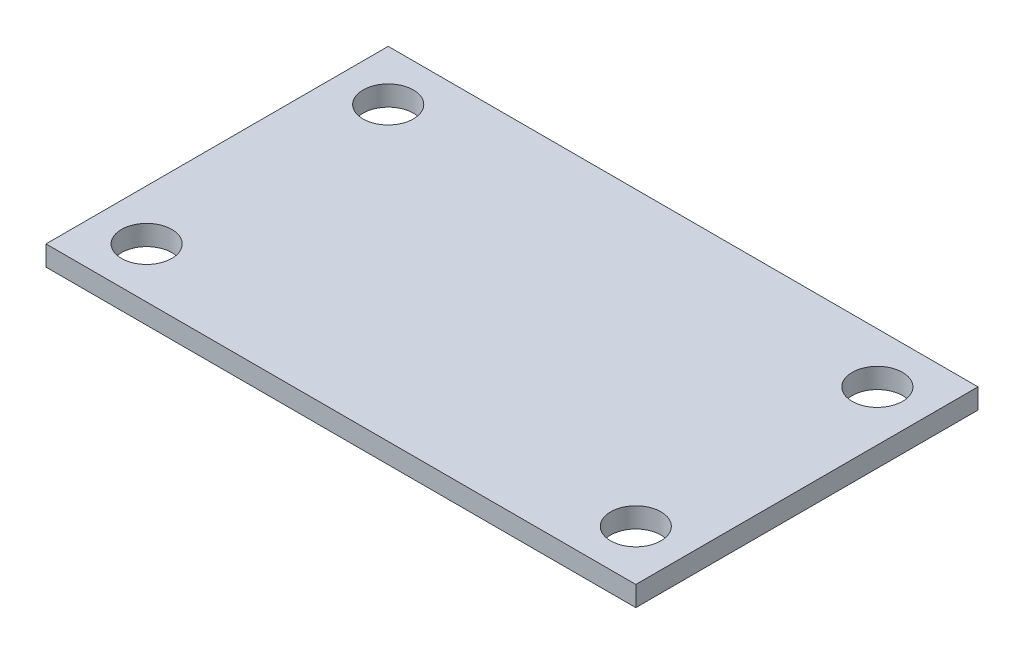
from build123d import *

# Parameters (mm, degrees)
SKETCH_1_W          = 29.3
SKETCH_1_H          = 17
EXTRUDE_1_DEPTH     = 1
SKETCH_2_R          = 1.25
CUT_EXTRUDE_1_DEPTH = 1


with BuildPart() as part:
    # 草图1 → 凸台-拉伸1 (new body)
    with BuildSketch(Plane(origin=(0, 0, 0), x_dir=(1, 0, 0), z_dir=(0, 1, 0))):
        Rectangle(SKETCH_1_W, SKETCH_1_H)
    extrude(amount=EXTRUDE_1_DEPTH)

    # 草图2 → 切除-拉伸1 (cut)
    with BuildSketch(Plane(origin=(0, 1, 0), x_dir=(1, 0, 0), z_dir=(0, 1, 0))):
        with Locations((-12.15, 6)):
            Circle(SKETCH_2_R)
        with Locations((12.15, 6)):
            Circle(SKETCH_2_R)
        with Locations((12.15, -6)):
            Circle(SKETCH_2_R)
        with Locations((-12.15, -6)):
            Circle(SKETCH_2_R)
    extrude(amount=-CUT_EXTRUDE_1_DEPTH, mode=Mode.SUBTRACT)


solid = part.part
